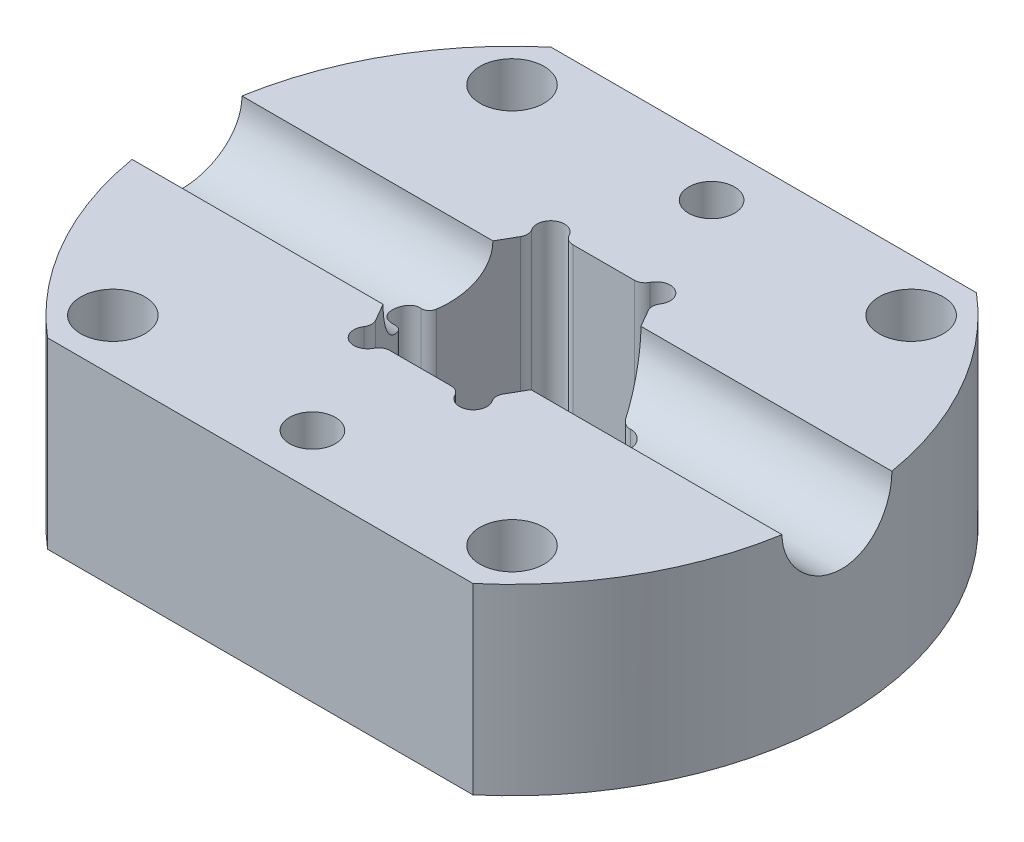
from build123d import *

# Parameters (mm, degrees)
SKIZZE1_R                        = 18
AUFSATZ_LINEAR_AUSTRAGEN1_DEPTH  = 10
SKIZZE2_OUTSIDE_W                = 48.376
SKIZZE2_OUTSIDE_H                = 48.376
SKIZZE2_OUTSIDE_W_2              = 36
SKIZZE2_OUTSIDE_H_2              = 27.5
SCHNITT_LINEAR_AUSTRAGEN1_DEPTH  = 10
SCHNITT_LINEAR_AUSTRAGEN2_DEPTH  = 10
SKIZZE4_R                        = 3
SCHNITT_LINEAR_AUSTRAGEN3_DEPTH  = 22.5
M3_GEWINDEBOHRUNG1_D             = 2.5
F_3_5_3_5_DURCHMESSER_BOHRUNG1_D = 3.5
SKIZZE9_R                        = 0.75
SCHNITT_LINEAR_AUSTRAGEN4_DEPTH  = 10
VERRUNDUNG1_R                    = 0.6


with BuildPart() as part:
    # Skizze1 → Aufsatz-Linear austragen1 (new body)
    with BuildSketch(Plane(origin=(0, 0, 0), x_dir=(1, 0, 0), z_dir=(0, 1, 0))):
        with Locations(Location((0, 0, 0), (0, 0, 270))):
            Circle(SKIZZE1_R)
    extrude(amount=AUFSATZ_LINEAR_AUSTRAGEN1_DEPTH)

    # Skizze2 outside → Schnitt-Linear austragen1 (cut)
    with BuildSketch(Plane(origin=(0, 10, 0), x_dir=(1, 0, 0), z_dir=(0, 1, 0))):
        Rectangle(SKIZZE2_OUTSIDE_W, SKIZZE2_OUTSIDE_H)
        Rectangle(SKIZZE2_OUTSIDE_W_2, SKIZZE2_OUTSIDE_H_2, mode=Mode.SUBTRACT)
    extrude(amount=-SCHNITT_LINEAR_AUSTRAGEN1_DEPTH, mode=Mode.SUBTRACT)

    # Skizze3 → Schnitt-Linear austragen2 (cut)
    with BuildSketch(Plane(origin=(0, 10, 0), x_dir=(1, 0, 0), z_dir=(0, 1, 0))):
        Polygon((2.886751346, 5), (-2.886751346, 5), (-5.773502692, 0), (-2.886751346, -5), (2.886751346, -5), (5.773502692, 0), align=None)
    extrude(amount=-SCHNITT_LINEAR_AUSTRAGEN2_DEPTH, mode=Mode.SUBTRACT)

    # Skizze4 → Schnitt-Linear austragen3 (cut, symmetric)
    with BuildSketch(Plane(origin=(0, 0, 0), x_dir=(0, 0, -1), z_dir=(1, 0, 0))):
        with Locations((0, 10)):
            Circle(SKIZZE4_R)
    extrude(amount=SCHNITT_LINEAR_AUSTRAGEN3_DEPTH, both=True, mode=Mode.SUBTRACT)

    # M3 Gewindebohrung1 (through all)
    with Locations(Plane(origin=(0, 10, 0), x_dir=(1, 0, 0), z_dir=(0, 1, 0))):
        with Locations((0, 10.9), (0, -10.9)):
            Hole(M3_GEWINDEBOHRUNG1_D / 2)

    # Ø3.5 (3.5) Durchmesser Bohrung1 (through all)
    with Locations(Plane(origin=(0, 10, 0), x_dir=(1, 0, 0), z_dir=(0, 1, 0))):
        with Locations((-10.9, 10.9), (10.9, 10.9), (10.9, -10.9), (-10.9, -10.9)):
            Hole(F_3_5_3_5_DURCHMESSER_BOHRUNG1_D / 2)

    # Skizze9 → Schnitt-Linear austragen4 (cut)
    with BuildSketch(Plane(origin=(0, 10, 0), x_dir=(1, 0, 0), z_dir=(0, 1, 0))):
        with Locations((-2.886751346, 5)):
            Circle(SKIZZE9_R)
        with Locations((2.886751346, 5)):
            Circle(SKIZZE9_R)
        with Locations((5.773502692, 0)):
            Circle(SKIZZE9_R)
        with Locations((2.886751346, -5)):
            Circle(SKIZZE9_R)
        with Locations((-2.886751346, -5)):
            Circle(SKIZZE9_R)
        with Locations((-5.773502692, 0)):
            Circle(SKIZZE9_R)
    extrude(amount=-SCHNITT_LINEAR_AUSTRAGEN4_DEPTH, mode=Mode.SUBTRACT)

    # Verrundung1
    # the kernel refuses this fillet: 0.6 mm, written as the material it takes off along each edge
    with BuildSketch(Plane(origin=(5.398502692, -1.148346656, -0.649519053), x_dir=(-0.4999999999999986, 0, -0.8660254037844394), z_dir=(0, 1, 0))) as verrundung1_piece_1:
        with BuildLine():
            CenterArc((0.459338662, -0.6), VERRUNDUNG1_R, 90, 63.612200039)
            ThreePointArc((-0.078145188, -0.333333333), (-0.019797593, -0.171185412), (0, 0))
            Line((0, 0), (0.459338662, 0))
        make_face()
    extrude(amount=9.367849683, mode=Mode.SUBTRACT)
    with BuildSketch(Plane(origin=(5.398502692, -1.148346656, 0.649519053), x_dir=(0.9572887202141677, 0, 0.2891337167310671), z_dir=(0, 1, 0))) as verrundung1_piece_2:
        with BuildLine():
            CenterArc((0.479319154, -0.584161925), VERRUNDUNG1_R, 103.193899981, 63.612200039)
            Line((-0.104842771, -0.447213595), (0, 0))
            ThreePointArc((0, 0), (0.171185412, -0.019797593), (0.342370824, 0))
        make_face()
    extrude(amount=9.367849683, mode=Mode.SUBTRACT)
    with BuildSketch(Plane(origin=(3.261751346, -1.148346656, 4.350480947), x_dir=(0.5000000000000002, 0, -0.8660254037844385), z_dir=(0, 1, 0)), Plane(origin=(-3.261751346, -1.148346656, -4.350480947), x_dir=(-0.5000000000000006, 0, 0.8660254037844383), z_dir=(0, 1, 0)), Plane(origin=(2.136751346, -1.148346656, -5), x_dir=(-1, 0, 0), z_dir=(0, 1, 0))) as verrundung1_piece_3:
        with BuildLine():
            CenterArc((0.459338662, -0.6), VERRUNDUNG1_R, 90, 63.612200039)
            ThreePointArc((-0.078145188, -0.333333333), (-0.019797593, -0.171185412), (0, 0))
            Line((0, 0), (0.459338662, 0))
        make_face()
    extrude(amount=12.296693311, mode=Mode.SUBTRACT)
    with BuildSketch(Plane(origin=(2.136751346, -1.148346656, 5), x_dir=(0.22824721632736691, 0, 0.9736032088272965), z_dir=(0, 1, 0)), Plane(origin=(-3.261751346, -1.148346656, 4.350480947), x_dir=(-0.7290415038868022, 0, 0.684469492096229), z_dir=(0, 1, 0)), Plane(origin=(3.261751346, -1.148346656, -4.350480947), x_dir=(0.7290415038868017, 0, -0.6844694920962296), z_dir=(0, 1, 0))) as verrundung1_piece_4:
        with BuildLine():
            CenterArc((0.479319154, -0.584161925), VERRUNDUNG1_R, 103.193899981, 63.612200039)
            Line((-0.104842771, -0.447213595), (0, 0))
            ThreePointArc((0, 0), (0.171185412, -0.019797593), (0.342370824, 0))
        make_face()
    extrude(amount=12.296693311, mode=Mode.SUBTRACT)
    with BuildSketch(Plane(origin=(-2.136751346, 11.148346656, 5), x_dir=(1, 0, 0), z_dir=(0, -1, 0))) as verrundung1_piece_5:
        with BuildLine():
            CenterArc((0.459338662, 0.6), VERRUNDUNG1_R, 206.387799961, 63.612200039)
            ThreePointArc((-0.078145188, 0.333333333), (-0.019797593, 0.171185412), (0, 0))
            Line((0, 0), (0.459338662, 0))
        make_face()
    extrude(amount=12.296693311, mode=Mode.SUBTRACT)
    with BuildSketch(Plane(origin=(-5.398502692, -1.148346656, 0.649519053), x_dir=(-0.9572887202141677, 0, 0.2891337167310672), z_dir=(0, 1, 0))) as verrundung1_piece_6:
        with BuildLine():
            CenterArc((0.479319154, 0.584161925), VERRUNDUNG1_R, 193.193899981, 63.612200039)
            Line((-0.104842771, 0.447213595), (0, 0))
            ThreePointArc((0, 0), (0.171185412, 0.019797593), (0.342370824, 0))
        make_face()
    extrude(amount=9.367849683, mode=Mode.SUBTRACT)
    with BuildSketch(Plane(origin=(-5.398502692, -1.148346656, -0.649519053), x_dir=(0.5000000000000002, 0, -0.8660254037844385), z_dir=(0, 1, 0))) as verrundung1_piece_7:
        with BuildLine():
            CenterArc((0.459338662, 0.6), VERRUNDUNG1_R, 206.387799961, 63.612200039)
            ThreePointArc((-0.078145188, 0.333333333), (-0.019797593, 0.171185412), (0, 0))
            Line((0, 0), (0.459338662, 0))
        make_face()
    extrude(amount=9.367849683, mode=Mode.SUBTRACT)
    with BuildSketch(Plane(origin=(-2.136751346, 11.148346656, -5), x_dir=(-0.22824721632736567, 0, -0.9736032088272967), z_dir=(0, -1, 0))) as verrundung1_piece_8:
        with BuildLine():
            CenterArc((0.479319154, 0.584161925), VERRUNDUNG1_R, 193.193899981, 63.612200039)
            Line((-0.104842771, 0.447213595), (0, 0))
            ThreePointArc((0, 0), (0.171185412, 0.019797593), (0.342370824, 0))
        make_face()
    extrude(amount=12.296693311, mode=Mode.SUBTRACT)


solid = part.part
